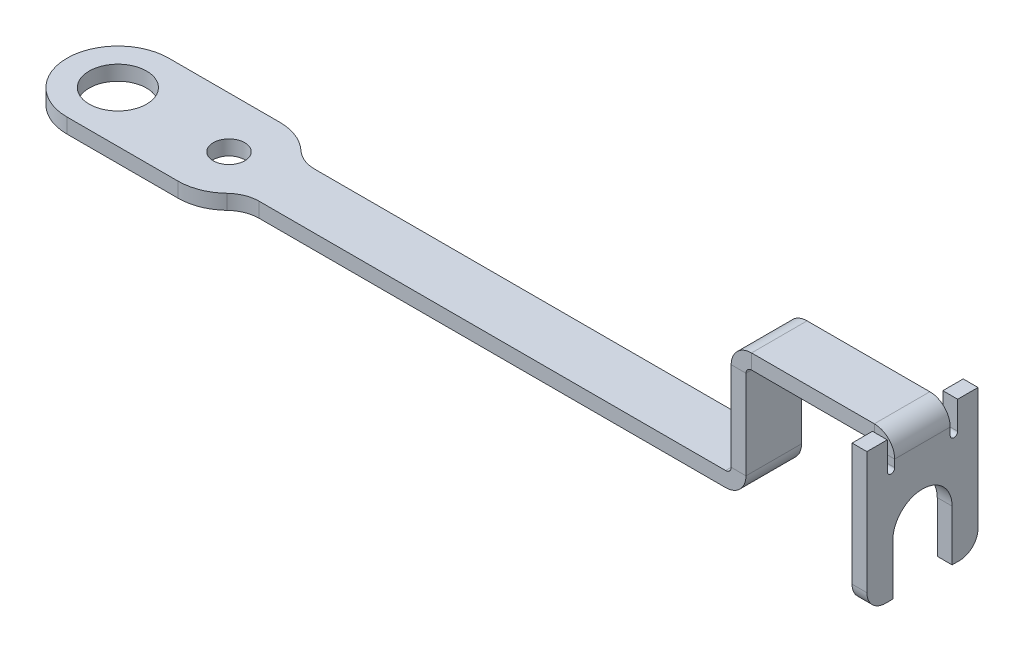
from build123d import *
from build123d.topology import SkipClean

# Parameters (mm, degrees)
SKETCH_20_W                      = 0.8
SKETCH_20_H                      = 7.6
SM_BASE_FLANGE_3_DEPTH           = 3
SM_EDGE_FLANGE_4_DEPTH           = 1.9
SM_EDGE_FLANGE_4_2_DEPTH         = 1.5
SM_EDGE_FLANGE_4_3_DEPTH         = 2
SM_EDGE_FLANGE_5_STRIP_W         = 3.8
SM_EDGE_FLANGE_5_STRIP_H         = 0.8
SM_EDGE_FLANGE_5_STRIP_CUT_DEPTH = 1.5
SM_EDGE_FLANGE_5_DEPTH           = 1.5
SM_EDGE_FLANGE_6_STRIP_W         = 3.8
SM_EDGE_FLANGE_6_STRIP_H         = 0.8
SM_EDGE_FLANGE_6_STRIP_CUT_DEPTH = 1.5
SM_EDGE_FLANGE_6_DEPTH           = 1.5
SM_EDGE_FLANGE_6_PROFILE_W       = 2.75
SM_EDGE_FLANGE_6_PROFILE_H       = 37.07
SM_EDGE_FLANGE_6_FLAT_DEPTH      = 0.8
CUT_EXTRUDE_3_DEPTH              = 47.034335012
CUT_EXTRUDE_4_REACH              = 48.794
FILLET_1_R                       = 1.8
FILLET_2_R                       = 1


with BuildPart() as part:
    # 基体-法兰3: sheet metal written as solids
    # 草图20 → 基体-法兰3 (new body)
    with BuildSketch(Plane.XY):
        with Locations((0.4, 3)):
            Rectangle(SKETCH_20_W, SKETCH_20_H)
    extrude(amount=SM_BASE_FLANGE_3_DEPTH)

    # 边线-法兰4: read off the stored shape, not the designer's step
    # 边线-法兰4 outline → 边线-法兰4 (cut)
    with BuildSketch(Plane.XY):
        with BuildLine():
            Line((0, 6.8), (0, 6.758300524))
            ThreePointArc((0, 6.758300524), (0.577496438, 6.363324958), (0.8, 5.7))
            Line((0.8, 5.7), (0.8, 6.8))
            Line((0.8, 6.8), (0, 6.8))
        make_face()
    extrude(amount=SM_EDGE_FLANGE_4_DEPTH, mode=Mode.SUBTRACT)

    # Sm Edge Flange 4 2 outline → Sm Edge Flange 4 2 (add)
    with BuildSketch(Plane.XY):
        with BuildLine():
            Line((-0.3, 6.8), (-8.03, 6.8))
            Line((-8.03, 6.8), (-8.03, 6))
            Line((-8.03, 6), (-0.3, 6))
            ThreePointArc((-0.3, 6), (-0.087867966, 5.912132034), (0, 5.7))
            Line((0, 5.7), (0, 6.758300524))
            ThreePointArc((0, 6.758300524), (-0.148557894, 6.789525258), (-0.3, 6.8))
        make_face()
    extrude(amount=SM_EDGE_FLANGE_4_2_DEPTH)

    # Sm Edge Flange 4 3 outline → Sm Edge Flange 4 3 (cut)
    with BuildSketch(Plane.YZ):
        with BuildLine():
            Line((5.3, 1.5), (8, 1.5))
            Line((8, 1.5), (8, 1.9))
            Line((8, 1.9), (5.3, 1.9))
            ThreePointArc((5.3, 1.9), (5.1, 1.7), (5.3, 1.5))
        make_face()
    extrude(amount=SM_EDGE_FLANGE_4_3_DEPTH, mode=Mode.SUBTRACT)

    # 边线-法兰5: sheet metal written as solids
    # 边线-法兰5 strip (on a plane across the edge) → 边线-法兰5 strip cut (cut)
    with BuildSketch(Plane(origin=(-8.03, 6, 1.5), x_dir=(1, 0, 0), z_dir=(0, 0, -1))):
        with Locations((-0.8, -0.4)):
            Rectangle(SM_EDGE_FLANGE_5_STRIP_W, SM_EDGE_FLANGE_5_STRIP_H)
    extrude(amount=SM_EDGE_FLANGE_5_STRIP_CUT_DEPTH, mode=Mode.SUBTRACT)

    # 边线-法兰5 section (on a plane across the edge) → 边线-法兰5 (add)
    with BuildSketch(Plane(origin=(-8.03, 6, 1.5), x_dir=(1, 0, 0), z_dir=(0, 0, -1))):
        with BuildLine():
            Line((0, 0.3), (0, 6.2))
            Line((0, 6.2), (0.8, 6.2))
            Line((0.8, 6.2), (0.8, 0.3))
            ThreePointArc((0.8, 0.3), (0.887867966, 0.087867966), (1.1, 0))
            Line((1.1, 0), (1.1, -0.8))
            ThreePointArc((1.1, -0.8), (0.322182541, -0.477817459), (0, 0.3))
        make_face()
    extrude(amount=SM_EDGE_FLANGE_5_DEPTH)

    # 边线-法兰6: sheet metal written as solids
    # 边线-法兰6 strip (on a plane across the edge) → 边线-法兰6 strip cut (cut)
    with BuildSketch(Plane(origin=(-8.03, -0.2, 0), x_dir=(0, 1, 0), z_dir=(0, 0, 1))):
        with Locations((-0.8, -0.4)):
            Rectangle(SM_EDGE_FLANGE_6_STRIP_W, SM_EDGE_FLANGE_6_STRIP_H)
    extrude(amount=SM_EDGE_FLANGE_6_STRIP_CUT_DEPTH, mode=Mode.SUBTRACT)

    # 边线-法兰6 bend section (on a plane across the edge) → 边线-法兰6 (add)
    with BuildSketch(Plane(origin=(-8.03, -0.2, 0), x_dir=(0, 1, 0), z_dir=(0, 0, 1))):
        with BuildLine():
            Line((0, 0.3), (0.8, 0.3))
            ThreePointArc((0.8, 0.3), (0.887867966, 0.087867966), (1.1, 0))
            Line((1.1, 0), (1.1, -0.8))
            ThreePointArc((1.1, -0.8), (0.322182541, -0.477817459), (0, 0.3))
        make_face()
    extrude(amount=SM_EDGE_FLANGE_6_DEPTH)

    # 边线-法兰6 profile (on flange) → 边线-法兰6 flat (add)
    with BuildSketch(Plane(origin=(-8.03, -0.2, 0), x_dir=(0, 0, 1), z_dir=(0, -1, 0))):
        with Locations((1.375, 18.835)):
            Rectangle(SM_EDGE_FLANGE_6_PROFILE_W, SM_EDGE_FLANGE_6_PROFILE_H)
    extrude(amount=-SM_EDGE_FLANGE_6_FLAT_DEPTH)

    # 草图37 → 切除-拉伸3 (cut, through all)
    with BuildSketch(Plane.XZ.offset(0.2)):
        with BuildLine():
            Line((-34.345113886, 1.5), (-8.33, 1.5))
            Line((-8.33, 1.5), (-8.33, 2.75))
            Line((-8.33, 2.75), (-36.65, 2.75))
            ThreePointArc((-36.65, 2.75), (-35.33898894, 2.417384951), (-34.345113886, 1.5))
        make_face()
        with BuildLine():
            Line((-37.5, 0), (-35.8, 0))
            ThreePointArc((-35.8, 0), (-36.65, 0.85), (-37.5, 0))
        make_face()
        with BuildLine():
            ThreePointArc((-45.4, 0), (-44.594543648, 1.944543648), (-42.65, 2.75))
            Line((-42.65, 2.75), (-45.4, 2.75))
            Line((-45.4, 2.75), (-45.4, 0))
        make_face()
        with BuildLine():
            Line((-44.2, 0), (-41.1, 0))
            ThreePointArc((-41.1, 0), (-42.65, 1.55), (-44.2, 0))
        make_face()
    extrude(amount=-CUT_EXTRUDE_3_DEPTH, mode=Mode.SUBTRACT)

    # 草图38 → 切除-拉伸4 (cut, up to next)
    with BuildSketch(Plane(origin=(0.8, 0, 0), x_dir=(0, 0, -1), z_dir=(1, 0, 0)), mode=Mode.PRIVATE) as cut_extrude_4_sk1:
        with BuildLine():
            Line((-1.6, 1.95), (-1.6, -0.8))
            Line((-1.6, -0.8), (0, -0.8))
            Line((0, -0.8), (0, 3.55))
            ThreePointArc((0, 3.55), (-1.13137085, 3.08137085), (-1.6, 1.95))
        make_face()
    cut_extrude_4_tool1 = extrude(cut_extrude_4_sk1.sketch, amount=-CUT_EXTRUDE_4_REACH, mode=Mode.PRIVATE) & part.part
    add(cut_extrude_4_tool1.solids().sort_by_distance((0.8, 1.219233, 0.762069))[0], mode=Mode.SUBTRACT)

    # 圆角1
    fillet_1_edges = [part.edges().sort_by_distance(p)[0] for p in [
        (-34.345113886, 0.2, 1.5),
    ]]
    fillet(fillet_1_edges, radius=FILLET_1_R)

    # 圆角2
    fillet_2_edges = [part.edges().sort_by_distance(p)[0] for p in [
        (0.4, -0.8, 3),
    ]]
    fillet(fillet_2_edges, radius=FILLET_2_R)

    # 镜向1: part across plane


with BuildPart() as part_1:
    with SkipClean():  # the faces are left unmerged after this step: merging them gives an invalid solid
        add(part.part)
        add(part.part.mirror(Plane(origin=(-8.03, -0.2, 0), x_dir=(1, 0, 0), z_dir=(0, 0, 1))))


solid = part_1.part
